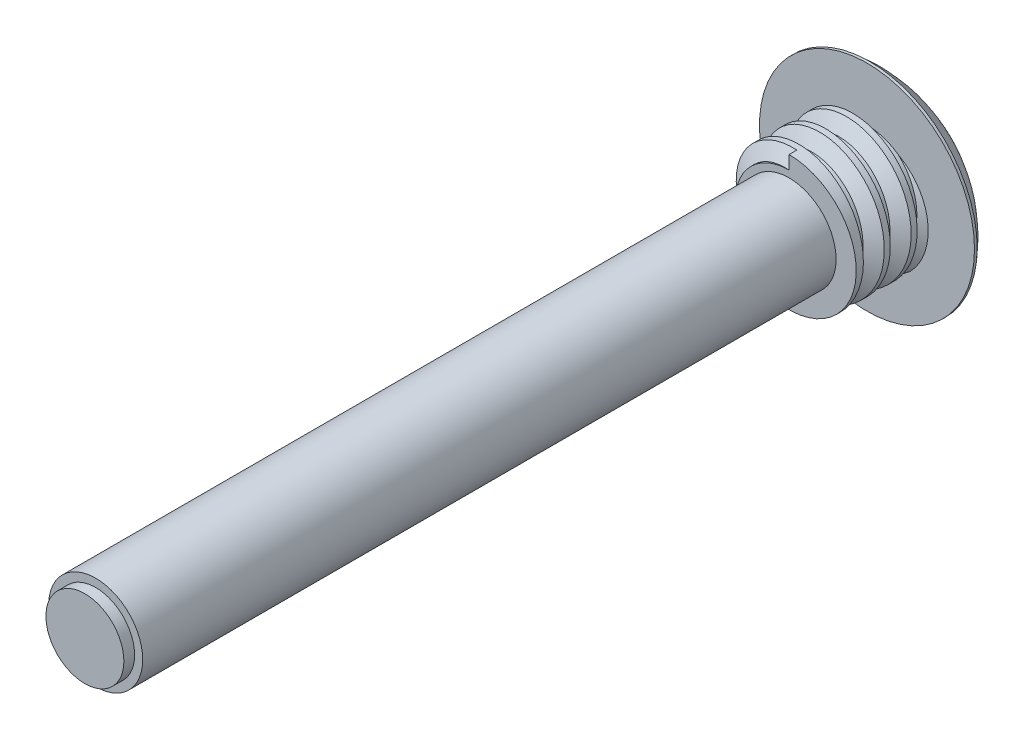
from build123d import *

# Parameters (mm, degrees)
SKETCH3_R           = 3.175
BOSS_EXTRUDE1_DEPTH = 3.683
CUT_SWEEP1_PITCH    = 1.27
SKETCH10_R          = 2.2225
BOSS_EXTRUDE5_DEPTH = 32.766
SKETCH9_R           = 5.08
BOSS_EXTRUDE4_DEPTH = 0.127
DOME3_FACE_RADIUS   = 5.08
DOME3_HEIGHT        = 2.38
SKETCH11_R          = 1.8415
BOSS_EXTRUDE6_DEPTH = 0.508


with BuildPart() as part:
    # Sketch3 → Boss-Extrude1 (new body)
    with BuildSketch(Plane.XY):
        Circle(SKETCH3_R)
    extrude(amount=BOSS_EXTRUDE1_DEPTH)

    # Cut-Sweep1: arcs per turn and ends read off the stored shape
    # Cut-Sweep1: the profile of Sketch5 profile screwed along a left-hand helix through 4 turns, 8 arcs to a turn; built about Z, then put on its axis
    cut_sweep1_z = Axis((0, 0, 0), (0, 0, 1))
    cut_sweep1_corners = [(2.54, 0, -1.397), (3.1753, 0, -1.763790626), (3.1753, 0, -0.776209374), (2.54, 0, -1.143)]
    with BuildLine(mode=Mode.PRIVATE) as cut_sweep1_profile:
        Line(cut_sweep1_corners[0], cut_sweep1_corners[1])
        Line(cut_sweep1_corners[1], cut_sweep1_corners[2])
        Line(cut_sweep1_corners[2], cut_sweep1_corners[3])
        Line(cut_sweep1_corners[3], cut_sweep1_corners[0])
    cut_sweep1_cap = Face(cut_sweep1_profile.wire())
    cut_sweep1_turn_angles = [0, -22.5, -45, -67.5, -90, -112.5, -135, -157.5, -180, -202.5, -225, -247.5, -270, -292.5, -315, -337.5, -360]
    cut_sweep1_turn_weights = [1, 0.9238795325112867, 1, 0.9238795325112867, 1, 0.9238795325112867, 1, 0.9238795325112867, 1, 0.9238795325112867, 1, 0.9238795325112867, 1, 0.9238795325112867, 1, 0.9238795325112867, 1]
    cut_sweep1_turn_rails = [Edge.make_bspline([Vector(p[0], p[1], 0).rotate(cut_sweep1_z, cut_sweep1_turn_angles[k]) / cut_sweep1_turn_weights[k] + Vector(0, 0, p[2] + -CUT_SWEEP1_PITCH * cut_sweep1_turn_angles[k] / 360) for k in range(17)], [0, 0, 0, 1, 1, 2, 2, 3, 3, 4, 4, 5, 5, 6, 6, 7, 7, 8, 8, 8], 2, cut_sweep1_turn_weights) for p in cut_sweep1_corners]
    cut_sweep1_turn_sides = [Face.make_surface_from_curves(cut_sweep1_turn_rails[p[0]], cut_sweep1_turn_rails[p[1]]) for p in [(0, 1), (1, 2), (2, 3), (3, 0)]]
    cut_sweep1 = Plane(origin=(0, 0, 0), x_dir=(0, 1, 0), z_dir=(0, 0, 1)) * Solid(Shell([*[p.moved(Location((0, 0, CUT_SWEEP1_PITCH * i))) for i in range(4) for p in cut_sweep1_turn_sides], cut_sweep1_cap, cut_sweep1_cap.rotate(cut_sweep1_z, -1440).moved(Location((0, 0, -CUT_SWEEP1_PITCH * -1440 / 360)))]))
    add(cut_sweep1, mode=Mode.SUBTRACT)

    # Sketch10 → Boss-Extrude5 (add)
    with BuildSketch(Plane.XY.offset(3.683)):
        Circle(SKETCH10_R)
    extrude(amount=BOSS_EXTRUDE5_DEPTH)

    # Sketch9 → Boss-Extrude4 (add)
    with BuildSketch(Plane.XY):
        Circle(SKETCH9_R)
    extrude(amount=-BOSS_EXTRUDE4_DEPTH)

    # Dome3: a dome of height H over a round flat face of radius A is a cap of a sphere of radius (A * A + H * H) / (2 * H)
    dome3_r = (DOME3_FACE_RADIUS * DOME3_FACE_RADIUS + DOME3_HEIGHT * DOME3_HEIGHT) / (2 * DOME3_HEIGHT)
    dome3_base = Plane((0, 0, -0.127), z_dir=(0, 0, -1))
    with Locations(dome3_base.offset(DOME3_HEIGHT - dome3_r)):
        dome3_ball = Sphere(dome3_r, mode=Mode.PRIVATE)
    add(split(dome3_ball, bisect_by=dome3_base, keep=Keep.TOP, mode=Mode.PRIVATE))

    # Sketch11 → Boss-Extrude6 (add)
    with BuildSketch(Plane.XY.offset(36.449)):
        Circle(SKETCH11_R)
    extrude(amount=BOSS_EXTRUDE6_DEPTH)


solid = part.part
